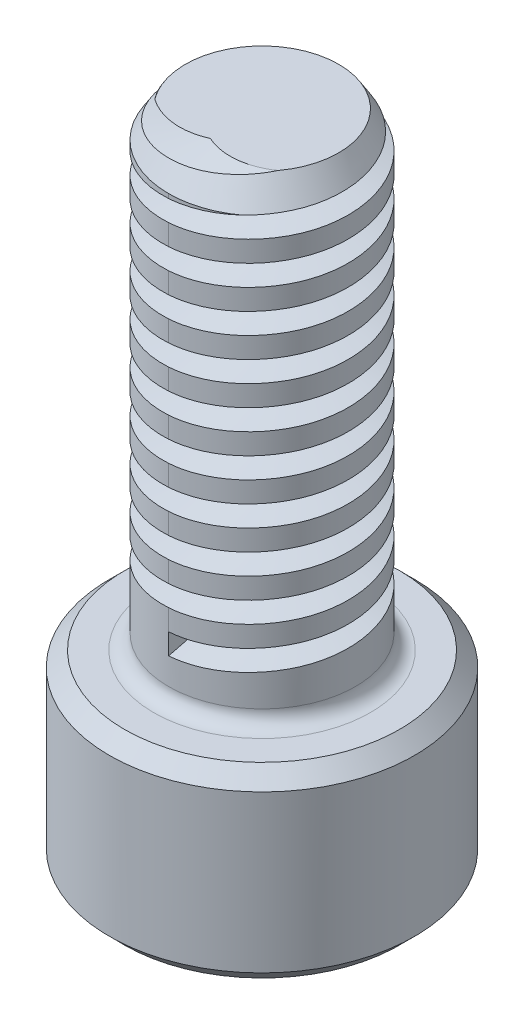
from build123d import *

# Parameters (mm, degrees)
CUT_SWEEP1_PITCH   = 0.635
CUT_EXTRUDE1_DEPTH = 1.2954
FILLET1_R          = 0.2286
FILLET2_R          = 0.396875794
CHAMFER2_SIZE      = 0.2286
CHAMFER3_SIZE      = 0.127


with BuildPart() as part:
    # Sketch1 → Revolve1 (revolve)
    with BuildSketch(Plane.XY, mode=Mode.PRIVATE) as revolve1_sk:
        Polygon((0, 0), (0, 9.98855), (1.4224, 9.98855), (1.4224, 2.8448), (2.3241, 2.8448), (2.3241, 0), align=None)
    revolve(revolve1_sk.sketch.rotate(Axis((0, 0, 0), (0, 1, 0)), 90), axis=Axis((0, 0, 0), (0, 1, 0)))

    # Cut-Sweep1: arcs per turn and ends read off the stored shape
    # Cut-Sweep1: the profile of Sketch3 profile screwed along a right-hand helix through 11 turns, 6 arcs to a turn; built about Z, then put on its axis
    cut_sweep1_z = Axis((0, 0, 0), (0, 0, 1))
    cut_sweep1_corners = [(1.4227, 0, -0.476175), (1.4227, 0, -0.793825), (0.78739873, 0, -0.635)]
    with BuildLine(mode=Mode.PRIVATE) as cut_sweep1_profile:
        Line(cut_sweep1_corners[0], cut_sweep1_corners[1])
        Line(cut_sweep1_corners[1], cut_sweep1_corners[2])
        Line(cut_sweep1_corners[2], cut_sweep1_corners[0])
    cut_sweep1_cap = Face(cut_sweep1_profile.wire())
    cut_sweep1_turn_angles = [0, 30, 60, 90, 120, 150, 180, 210, 240, 270, 300, 330, 360]
    cut_sweep1_turn_weights = [1, 0.8660254037844387, 1, 0.8660254037844387, 1, 0.8660254037844387, 1, 0.8660254037844387, 1, 0.8660254037844387, 1, 0.8660254037844387, 1]
    cut_sweep1_turn_rails = [Edge.make_bspline([Vector(p[0], p[1], 0).rotate(cut_sweep1_z, cut_sweep1_turn_angles[k]) / cut_sweep1_turn_weights[k] + Vector(0, 0, p[2] + CUT_SWEEP1_PITCH * cut_sweep1_turn_angles[k] / 360) for k in range(13)], [0, 0, 0, 1, 1, 2, 2, 3, 3, 4, 4, 5, 5, 6, 6, 6], 2, cut_sweep1_turn_weights) for p in cut_sweep1_corners]
    cut_sweep1_turn_sides = [Face.make_surface_from_curves(cut_sweep1_turn_rails[p[0]], cut_sweep1_turn_rails[p[1]]) for p in [(0, 1), (1, 2), (2, 0)]]
    cut_sweep1 = Plane(origin=(0, 9.98855, 0), x_dir=(0, 0, 1), z_dir=(0, -1, 0)) * Solid(Shell([*[p.moved(Location((0, 0, CUT_SWEEP1_PITCH * i))) for i in range(11) for p in cut_sweep1_turn_sides], cut_sweep1_cap, cut_sweep1_cap.rotate(cut_sweep1_z, 3960).moved(Location((0, 0, CUT_SWEEP1_PITCH * 3960 / 360)))]))
    add(cut_sweep1, mode=Mode.SUBTRACT)

    # Sketch4 → Cut-Extrude1 (cut)
    with BuildSketch(Plane(origin=(0, 0, 0), x_dir=(1, 0, 0), z_dir=(0, 1, 0))):
        Polygon((0, 1.378481503), (-1.1938, 0.689240751), (-1.1938, -0.689240751), (0, -1.378481503), (1.1938, -0.689240751), (1.1938, 0.689240751), align=None)
    extrude(amount=CUT_EXTRUDE1_DEPTH, mode=Mode.SUBTRACT)

    # Fillet1
    fillet1_edges = [part.edges().sort_by_distance(p)[0] for p in [
        (0, 2.8448, 1.4224),
    ]]
    fillet(fillet1_edges, radius=FILLET1_R)

    # Fillet2
    fillet2_edges = [part.edges().sort_by_distance(p)[0] for p in [
        (1.1938, 0.6477, -0.689240751),
        (0, 0.6477, -1.378481503),
        (-1.1938, 0.6477, -0.689240751),
        (-1.1938, 0.6477, 0.689240751),
        (0, 0.6477, 1.378481503),
        (1.1938, 0.6477, 0.689240751),
        (0.5969, 1.2954, -1.033861127),
        (-0.5969, 1.2954, -1.033861127),
        (-1.1938, 1.2954, 0),
        (-0.5969, 1.2954, 1.033861127),
        (0.5969, 1.2954, 1.033861127),
        (1.1938, 1.2954, 0),
    ]]
    fillet(fillet2_edges, radius=FILLET2_R)

    # Chamfer1: read off the stored shape, not the designer's step
    # Chamfer1 outline → Chamfer1 (revolve, cut)
    with BuildSketch(Plane.XY):
        Polygon((1.4224, 9.98855), (1.168399492, 9.98855), (1.4224, 9.577126279), align=None)
    revolve(axis=Axis((0, 0, 0), (0, 1, 0)), mode=Mode.SUBTRACT)

    # Chamfer2
    chamfer2_edges = [part.edges().sort_by_distance(p)[0] for p in [
        (0, 0, 2.3241),
        (0, 2.8448, 2.3241),
    ]]
    chamfer(chamfer2_edges, length=CHAMFER2_SIZE)

    # Chamfer3
    chamfer3_edges = [part.edges().sort_by_distance(p)[0] for p in [
        (0.5969, 0, -1.033861127),
        (-0.5969, 0, -1.033861127),
        (-1.1938, 0, 0),
        (-0.5969, 0, 1.033861127),
        (0.5969, 0, 1.033861127),
        (1.1938, 0, 0),
        (0, 0, -1.317084604),
        (1.140628726, 0, -0.658542302),
        (1.140628726, 0, 0.658542302),
        (0, 0, 1.317084604),
        (-1.140628726, 0, 0.658542302),
        (-1.140628726, 0, -0.658542302),
    ]]
    chamfer(chamfer3_edges, length=CHAMFER3_SIZE)


solid = part.part
